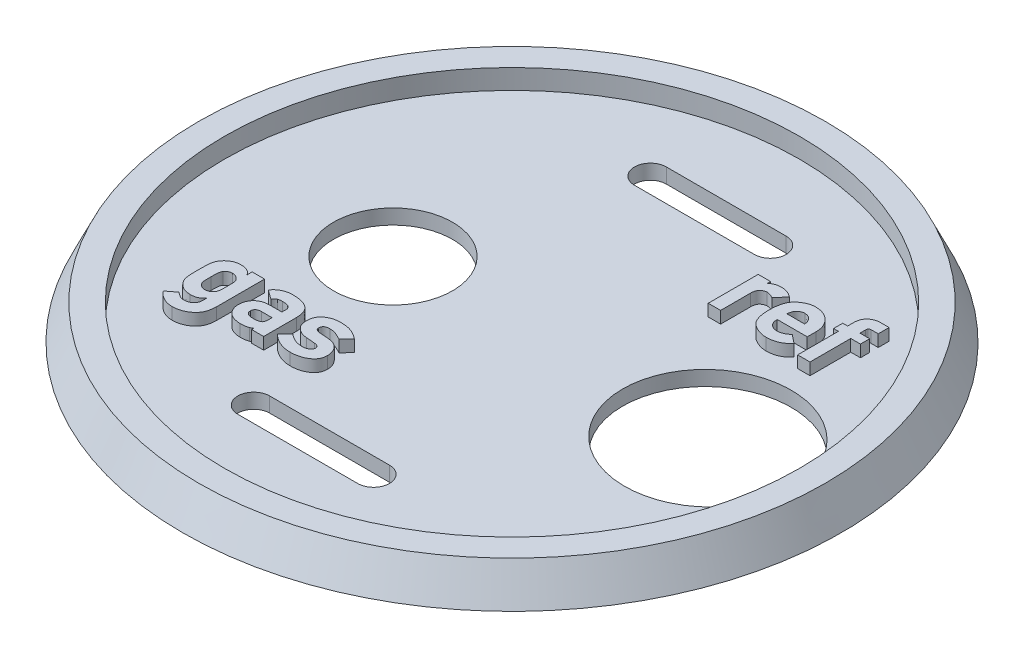
from build123d import *

# Parameters (mm, degrees)
SKIZZE1_R                       = 15.8
SKIZZE1_R_2                     = 3
SKIZZE1_RX                      = 4.3
SKIZZE1_RY                      = 4.2
AUFSATZ_LINEAR_AUSTRAGEN1_DEPTH = 0.75
SKIZZE5_R                       = 15.8
SKIZZE5_R_2                     = 14.5
AUFSATZ_LINEAR_AUSTRAGEN2_DEPTH = 1
FORMSCHR_GE4_ANGLE              = 25
AUFSATZ_LINEAR_AUSTRAGEN3_DEPTH = 0.6


# Read off the part's stored shape, not the designer's step: Aufsatz-Linear austragen3
with BuildPart() as part:
    # Skizze1 → Aufsatz-Linear austragen1 (new body)
    with BuildSketch(Plane(origin=(0, 0, 0), x_dir=(1, 0, 0), z_dir=(0, 1, 0))):
        with Locations(Location((0, 0, 0), (0, 0, 270))):
            Circle(SKIZZE1_R)
        with Locations(Location((-6, 0, 0), (0, 0, 270))):
            Circle(SKIZZE1_R_2, mode=Mode.SUBTRACT)
        with Locations(Location((9.871892508, 0.003631049), (0, 0, -180))):
            Ellipse(SKIZZE1_RX, SKIZZE1_RY, mode=Mode.SUBTRACT)
        with BuildLine():
            Line((-3.021815197, 10.801670903), (3.021815197, 10.801670903))
            ThreePointArc((3.021815197, 10.801670903), (3.8234861, 10), (3.021815197, 9.198329097))
            Line((3.021815197, 9.198329097), (-3.021815197, 9.198329097))
            ThreePointArc((-3.021815197, 9.198329097), (-3.8234861, 10), (-3.021815197, 10.801670903))
        make_face(mode=Mode.SUBTRACT)
        with BuildLine():
            Line((3.021815197, -10.801670903), (-3.021815197, -10.801670903))
            ThreePointArc((-3.021815197, -10.801670903), (-3.8234861, -10), (-3.021815197, -9.198329097))
            Line((-3.021815197, -9.198329097), (3.021815197, -9.198329097))
            ThreePointArc((3.021815197, -9.198329097), (3.8234861, -10), (3.021815197, -10.801670903))
        make_face(mode=Mode.SUBTRACT)
    extrude(amount=AUFSATZ_LINEAR_AUSTRAGEN1_DEPTH)

    # Skizze5 → Aufsatz-Linear austragen2 (add)
    with BuildSketch(Plane(origin=(0, 0.75, 0), x_dir=(1, 0, 0), z_dir=(0, 1, 0))):
        with Locations(Location((0, 0, 0), (0, 0, 270))):
            Circle(SKIZZE5_R)
        with Locations(Location((0, 0, 0), (0, 0, 270))):
            Circle(SKIZZE5_R_2, mode=Mode.SUBTRACT)
    extrude(amount=AUFSATZ_LINEAR_AUSTRAGEN2_DEPTH)

    # Formschräge4
    formschr_ge4_faces = [part.faces().sort_by_distance(p)[0] for p in [
        (0, 0.875, -15.8),
    ]]
    draft(formschr_ge4_faces, Plane.ZX.offset(1.75), FORMSCHR_GE4_ANGLE)

    # Aufsatz-Linear austragen3 outline → Aufsatz-Linear austragen3 (add)
    # profile 1 of 6: a face of its own
    with BuildSketch(Plane(origin=(0, 0.75, 0), x_dir=(1, 0, 0), z_dir=(0, 1, 0))):
        with BuildLine():
            add(Edge.make_bspline(
                [(5.594777271, 7.274511402), (5.572274733, 7.273271201), (5.526936052, 7.270772412), (5.460281754, 7.250652892), (5.395773381, 7.217753155), (5.344286733, 7.181610721), (5.30513894, 7.145816765), (5.280950543, 7.111902892), (5.258951502, 7.07413947), (5.242961741, 7.030608338), (5.227999758, 6.983248107), (5.219580745, 6.930211049), (5.21380078, 6.872644291), (5.212983232, 6.832495351), (5.21256088, 6.811754034)],
                knots=[0, 0, 0, 0, 0.099498386, 0.200471866, 0.3053898, 0.419085264, 0.47808674, 0.539188308, 0.602689317, 0.671038746, 0.743944571, 0.822284683, 0.90819061, 1, 1, 1, 1], degree=3))
            add(Edge.make_bspline(
                [(5.945201171, 7.155112936), (5.912791431, 7.173186855), (5.851868398, 7.207161763), (5.760552823, 7.245632813), (5.675522378, 7.26886791), (5.620563609, 7.272709126), (5.594777271, 7.274511402)],
                knots=[0, 0, 0, 0, 0.297393514, 0.559033041, 0.793100837, 1, 1, 1, 1], degree=3))
            Line((5.945201171, 7.155112936), (6.362036051, 7.624935302))
            add(Edge.make_bspline(
                [(5.763630722, 7.853841237), (5.789331534, 7.853143327), (5.840714801, 7.851748005), (5.917469057, 7.840994572), (5.993127837, 7.82211888), (6.068767837, 7.797547478), (6.143188795, 7.76476734), (6.217477323, 7.725593339), (6.290931032, 7.679001486), (6.338032516, 7.643186891), (6.362036051, 7.624935302)],
                knots=[0, 0, 0, 0, 0.118054796, 0.23602528, 0.355160884, 0.475935911, 0.600954289, 0.7282414, 0.861508245, 1, 1, 1, 1], degree=3))
            add(Edge.make_bspline(
                [(5.212560879, 7.67317947), (5.22020279, 7.679625296), (5.250684407, 7.704257931), (5.307252687, 7.743561141), (5.387005217, 7.783409387), (5.472350426, 7.815723411), (5.563938783, 7.83794777), (5.661704337, 7.851795364), (5.728963181, 7.853145388), (5.763630722, 7.853841237)],
                knots=[0.201261024, 0.201261024, 0.201261024, 0.201261024, 0.241658565, 0.359532571, 0.479274951, 0.601389739, 0.728030172, 0.859817318, 1, 1, 1, 1], degree=3))
            Line((5.212560879, 7.67317947), (5.21256088, 7.825581245))
            Line((5.21256088, 7.825581245), (4.588015058, 7.825581245))
            Line((4.588015058, 7.825581245), (4.588015058, 5.306202965))
            Line((4.588015058, 5.306202965), (5.21256088, 5.306202965))
            Line((5.21256088, 5.306202965), (5.21256088, 6.811754034))
        make_face()
    # profile 2 of 6: a face of its own
    with BuildSketch(Plane(origin=(0, 0.75, 0), x_dir=(1, 0, 0), z_dir=(0, 1, 0))):
        with BuildLine():
            add(Edge.make_bspline(
                [(7.459936738, 7.853841237), (7.49647644, 7.852788335), (7.568623396, 7.850709401), (7.675144541, 7.837274056), (7.777594798, 7.814027121), (7.875931582, 7.78113422), (7.970558428, 7.739434321), (8.060781286, 7.687438107), (8.147830715, 7.627309908), (8.228857683, 7.557353184), (8.304469929, 7.481502005), (8.369808136, 7.398077117), (8.425314913, 7.309303247), (8.47076957, 7.214751355), (8.506025266, 7.114732059), (8.531763737, 7.009247005), (8.546574256, 6.898136191), (8.548420066, 6.822159651), (8.549359426, 6.783494043)],
                knots=[0, 0, 0, 0, 0.064232761, 0.126826381, 0.188388862, 0.248608799, 0.308842963, 0.369844725, 0.431400246, 0.494533665, 0.557766089, 0.619382831, 0.680378974, 0.741481792, 0.803414805, 0.86647081, 0.932044978, 1, 1, 1, 1], degree=3))
            add(Edge.make_bspline(
                [(6.412904037, 6.556707607), (6.413613866, 6.615395493), (6.414976698, 6.728073086), (6.431931536, 6.889984204), (6.457020626, 7.03844676), (6.494384065, 7.172856119), (6.541585953, 7.293761227), (6.599534611, 7.400664124), (6.668286685, 7.494002801), (6.748542973, 7.571362761), (6.833521428, 7.637126774), (6.919954725, 7.694788027), (7.007670629, 7.743558821), (7.096075416, 7.784224462), (7.185469608, 7.815608799), (7.275902201, 7.837403862), (7.367404437, 7.851616389), (7.429034069, 7.853098213), (7.459936738, 7.853841237)],
                knots=[0, 0, 0, 0, 0.093520416, 0.179554186, 0.259240353, 0.333296408, 0.401549333, 0.465730169, 0.52662602, 0.585563443, 0.642792451, 0.69777167, 0.751047831, 0.802626189, 0.852732437, 0.901812665, 0.950766367, 1, 1, 1, 1], degree=3))
            add(Edge.make_bspline(
                [(7.534825716, 5.277942973), (7.502532424, 5.278875348), (7.437991379, 5.280738782), (7.341289775, 5.292223544), (7.245256084, 5.311826193), (7.150358366, 5.34072537), (7.056023962, 5.375969744), (6.962219719, 5.419346154), (6.869444962, 5.471184594), (6.777030772, 5.529351508), (6.690066646, 5.600685514), (6.614664242, 5.689644475), (6.551464405, 5.794998302), (6.501123675, 5.916695863), (6.461019938, 6.053836551), (6.432542951, 6.207175214), (6.415830387, 6.376648252), (6.413907458, 6.494966785), (6.412904037, 6.556707607)],
                knots=[0, 0, 0, 0, 0.049929251, 0.099788093, 0.150343999, 0.201260482, 0.25299445, 0.305939118, 0.360860028, 0.41721413, 0.474600885, 0.533996877, 0.596564565, 0.663783815, 0.737055331, 0.817104758, 0.904561844, 1, 1, 1, 1], degree=3))
            add(Edge.make_bspline(
                [(8.50273044, 5.715972848), (8.469190001, 5.678172719), (8.403697712, 5.604362803), (8.293575803, 5.510034711), (8.177261038, 5.433293975), (8.055036271, 5.374491206), (7.9285532, 5.332157532), (7.799862178, 5.300410445), (7.668192241, 5.281802089), (7.579391591, 5.279232538), (7.534825716, 5.277942973)],
                knots=[0, 0, 0, 0, 0.137781087, 0.269036401, 0.394342038, 0.517075142, 0.637997965, 0.757705624, 0.878401107, 1, 1, 1, 1], degree=3))
            Line((8.50273044, 5.715972848), (8.068939564, 6.060744749))
            add(Edge.make_bspline(
                [(7.524934719, 5.826893316), (7.54853129, 5.827514794), (7.595762063, 5.828758742), (7.665819561, 5.84065769), (7.735083284, 5.859230483), (7.803667177, 5.884792827), (7.871913088, 5.917409564), (7.938860775, 5.957925145), (8.005273026, 6.005645328), (8.04731605, 6.042030945), (8.068939564, 6.060744749)],
                knots=[0, 0, 0, 0, 0.116758416, 0.233703032, 0.350810329, 0.471463667, 0.595600107, 0.724793131, 0.858455956, 1, 1, 1, 1], degree=3))
            add(Edge.make_bspline(
                [(7.037449858, 6.335573171), (7.037742132, 6.31552616), (7.038311456, 6.276476372), (7.046035562, 6.219890072), (7.055987857, 6.1664636), (7.071721467, 6.11705467), (7.091406778, 6.071080433), (7.116547517, 6.029565411), (7.144774424, 5.990654905), (7.188840662, 5.945250782), (7.251771049, 5.898312323), (7.335517332, 5.856243021), (7.427971776, 5.831791453), (7.492057736, 5.828554115), (7.524934719, 5.826893316)],
                knots=[0, 0, 0, 0, 0.075640559, 0.147341055, 0.215362118, 0.280617751, 0.342744036, 0.40375269, 0.463517074, 0.523900249, 0.642004498, 0.758140234, 0.8759226, 1, 1, 1, 1], degree=3))
            Line((7.037449858, 6.335573171), (8.549359426, 6.335573171))
            Line((8.549359426, 6.335573171), (8.549359426, 6.783494043))
        make_face()
        with BuildLine():
            add(Edge.make_bspline(
                [(7.459936738, 7.302064894), (7.432917493, 7.300615242), (7.379482064, 7.297748294), (7.302051701, 7.273270739), (7.230452637, 7.232787905), (7.165679117, 7.177496065), (7.109622734, 7.108888779), (7.069319637, 7.025966997), (7.044313182, 6.931128883), (7.039812077, 6.863960547), (7.037449858, 6.82871003)],
                knots=[0, 0, 0, 0, 0.114540899, 0.226525281, 0.341149106, 0.46177623, 0.586259529, 0.714623416, 0.850231929, 1, 1, 1, 1], degree=3))
            add(Edge.make_bspline(
                [(7.926933104, 6.82871003), (7.923852436, 6.862109571), (7.917871736, 6.926950249), (7.889855632, 7.018949027), (7.846113664, 7.101026953), (7.787797388, 7.171551451), (7.719057837, 7.229995441), (7.639994866, 7.271816101), (7.552650426, 7.297478224), (7.491437307, 7.300506519), (7.459936738, 7.302064894)],
                knots=[0, 0, 0, 0, 0.135981388, 0.263989416, 0.387677885, 0.511392248, 0.633633148, 0.751750516, 0.872249606, 1, 1, 1, 1], degree=3))
            Line((7.926933104, 6.82871003), (7.037449858, 6.82871003))
        make_face(mode=Mode.SUBTRACT)
    # profile 3 of 6: a face of its own
    with BuildSketch(Plane(origin=(0, 0.75, 0), x_dir=(1, 0, 0), z_dir=(0, 1, 0))):
        with BuildLine():
            add(Edge.make_bspline(
                [(9.841547557, 8.257252621), (9.831809849, 8.257058821), (9.813381816, 8.256692066), (9.788060769, 8.24821283), (9.765969731, 8.236470062), (9.748699392, 8.218289329), (9.734041825, 8.196373757), (9.725468034, 8.168480589), (9.719746554, 8.136448206), (9.719009282, 8.113394918), (9.718616592, 8.101116166)],
                knots=[0, 0, 0, 0, 0.128040819, 0.242309607, 0.349707563, 0.455421277, 0.570325014, 0.695414922, 0.837770441, 1, 1, 1, 1], degree=3))
            Line((9.841547557, 8.257252621), (10.207514453, 8.257252621))
            Line((10.207514453, 8.257252621), (10.207514453, 8.806202965))
            Line((10.207514453, 8.806202965), (9.801277069, 8.806202965))
            add(Edge.make_bspline(
                [(9.09619027, 8.101116166), (9.09656361, 8.130117438), (9.097288398, 8.186419475), (9.10768474, 8.26766218), (9.122950808, 8.343423282), (9.144648104, 8.413401033), (9.172852897, 8.477587295), (9.2081169, 8.535482188), (9.248889448, 8.588151597), (9.29674375, 8.634103841), (9.349208761, 8.67394115), (9.404248781, 8.709640812), (9.462834216, 8.739382597), (9.524417337, 8.764359855), (9.589335047, 8.783165185), (9.657146108, 8.796774671), (9.728093718, 8.804466788), (9.776531487, 8.805615909), (9.801277069, 8.806202965)],
                knots=[0, 0, 0, 0, 0.076827064, 0.149149332, 0.216733255, 0.281496126, 0.3429806, 0.402079863, 0.460775488, 0.519051306, 0.577363893, 0.635203383, 0.692718536, 0.751261247, 0.811117321, 0.871598448, 0.934403027, 1, 1, 1, 1], degree=3))
            Line((9.09619027, 8.101116166), (9.09619027, 7.825581245))
            Line((9.09619027, 7.825581245), (8.85032834, 7.825581245))
            Line((8.85032834, 7.825581245), (8.85032834, 7.360704378))
            Line((8.85032834, 7.360704378), (9.09619027, 7.360704378))
            Line((9.09619027, 7.360704378), (9.09619027, 5.306202965))
            Line((9.09619027, 5.306202965), (9.718616592, 5.306202965))
            Line((9.718616592, 5.306202965), (9.718616592, 7.360704378))
            Line((9.718616592, 7.360704378), (10.207514453, 7.360704378))
            Line((10.207514453, 7.360704378), (10.207514453, 7.825581245))
            Line((10.207514453, 7.825581245), (9.718616592, 7.825581245))
            Line((9.718616592, 7.825581245), (9.718616592, 8.101116166))
        make_face()
    # profile 4 of 6: a face of its own
    with BuildSketch(Plane(origin=(0, 0.75, 0), x_dir=(1, 0, 0), z_dir=(0, 1, 0))):
        with BuildLine():
            add(Edge.make_bspline(
                [(-8.786462717, -7.773772884), (-8.750525686, -7.772411654), (-8.681129221, -7.76978304), (-8.58256476, -7.745976557), (-8.493941845, -7.707549942), (-8.429851593, -7.661708841), (-8.385281972, -7.618312236), (-8.355934764, -7.582245251), (-8.332286098, -7.542063851), (-8.311054642, -7.499475608), (-8.295801964, -7.452780696), (-8.285676632, -7.402943878), (-8.277898491, -7.35011163), (-8.277356689, -7.313637581), (-8.277076363, -7.294766021)],
                knots=[0, 0, 0, 0, 0.136119332, 0.262854222, 0.382020109, 0.500491066, 0.55923121, 0.617678621, 0.67619424, 0.7357169, 0.797855953, 0.861798346, 0.928494889, 1, 1, 1, 1], degree=3))
            add(Edge.make_bspline(
                [(-9.240035587, -7.554051447), (-9.21780473, -7.571430438), (-9.175340854, -7.604626607), (-9.112548294, -7.649057808), (-9.054294186, -7.686707139), (-9.000227135, -7.718841305), (-8.947350391, -7.743469815), (-8.894193833, -7.76055335), (-8.840622097, -7.771710083), (-8.80441357, -7.773089179), (-8.786462717, -7.773772884)],
                knots=[0, 0, 0, 0, 0.16476028, 0.314713908, 0.448984483, 0.569751839, 0.681744177, 0.788727359, 0.895258815, 1, 1, 1, 1], degree=3))
            Line((-9.240035587, -7.554051447), (-9.68583696, -7.895290849))
            add(Edge.make_bspline(
                [(-8.795647214, -8.353102719), (-8.836485636, -8.351792731), (-8.918279946, -8.349168988), (-9.03998382, -8.326225322), (-9.159785748, -8.289236204), (-9.277207727, -8.238310733), (-9.390197164, -8.173395519), (-9.496935207, -8.094312728), (-9.596349618, -8.001240389), (-9.655669934, -7.931007437), (-9.68583696, -7.895290849)],
                knots=[0, 0, 0, 0, 0.118194245, 0.236728465, 0.357330633, 0.480744861, 0.606629784, 0.733905784, 0.864679226, 1, 1, 1, 1], degree=3))
            add(Edge.make_bspline(
                [(-7.652530541, -7.241072036), (-7.653686742, -7.285858504), (-7.655933398, -7.37288465), (-7.671258653, -7.49933024), (-7.698118177, -7.617215555), (-7.735399455, -7.726582703), (-7.783610986, -7.827445174), (-7.843587509, -7.918852863), (-7.913195593, -8.002704452), (-7.993876099, -8.076175525), (-8.08140643, -8.140327698), (-8.172269289, -8.197578677), (-8.267016866, -8.245846316), (-8.365936121, -8.284340791), (-8.467869689, -8.316443777), (-8.574160137, -8.336490955), (-8.683618397, -8.351068254), (-8.757915851, -8.35241751), (-8.795647214, -8.353102719)],
                knots=[0, 0, 0, 0, 0.074731466, 0.145213318, 0.212134603, 0.276136519, 0.337653162, 0.398147114, 0.458123181, 0.519029285, 0.579705489, 0.639022636, 0.698073635, 0.756817859, 0.815989033, 0.876102698, 0.937079755, 1, 1, 1, 1], degree=3))
            Line((-7.652530541, -7.241072036), (-7.652530541, -4.822723227))
            Line((-7.652530541, -4.822723227), (-8.277076363, -4.822723227))
            Line((-8.277076363, -4.822723227), (-8.277076363, -5.082715153))
            add(Edge.make_bspline(
                [(-8.859232196, -4.794463235), (-8.826448994, -4.795170045), (-8.762941466, -4.796539276), (-8.671422403, -4.810086574), (-8.587088212, -4.832525848), (-8.510224485, -4.864590995), (-8.440045529, -4.905024521), (-8.377361567, -4.954917652), (-8.321996085, -5.014209066), (-8.292215639, -5.059626573), (-8.277076363, -5.082715153)],
                knots=[0, 0, 0, 0, 0.144192803, 0.279329894, 0.406041415, 0.527299421, 0.644796431, 0.761334228, 0.87867115, 1, 1, 1, 1], degree=3))
            add(Edge.make_bspline(
                [(-9.536059003, -5.110268645), (-9.520170754, -5.091791256), (-9.486988731, -5.053201908), (-9.427414633, -4.99963013), (-9.358035828, -4.946980153), (-9.279500345, -4.895103086), (-9.190163068, -4.849065786), (-9.088754146, -4.817002234), (-8.977246575, -4.79774013), (-8.899585005, -4.795583708), (-8.859232196, -4.794463235)],
                knots=[0, 0, 0, 0, 0.094503238, 0.197366533, 0.310162489, 0.432358369, 0.562346021, 0.698777765, 0.843485481, 1, 1, 1, 1], degree=3))
            add(Edge.make_bspline(
                [(-9.728226948, -6.084531867), (-9.728127204, -6.043553278), (-9.727936874, -5.965358155), (-9.725547698, -5.853732982), (-9.723060364, -5.753384973), (-9.718865973, -5.664104595), (-9.713368349, -5.585881958), (-9.706603535, -5.518674275), (-9.698072228, -5.462614038), (-9.68633907, -5.402083539), (-9.664312709, -5.334840055), (-9.630748041, -5.257728894), (-9.588633257, -5.181842296), (-9.553787866, -5.134404403), (-9.536059003, -5.110268645)],
                knots=[0, 0, 0, 0, 0.121158019, 0.231193084, 0.330106756, 0.41793984, 0.495429499, 0.561943363, 0.617581964, 0.663055137, 0.744095482, 0.826108149, 0.911526182, 1, 1, 1, 1], degree=3))
            add(Edge.make_bspline(
                [(-9.536059003, -7.058795088), (-9.553744636, -7.034874302), (-9.588371761, -6.988039222), (-9.63110838, -6.913186279), (-9.664264131, -6.836314982), (-9.686334137, -6.76910184), (-9.698141068, -6.708343365), (-9.706530541, -6.652027023), (-9.713383564, -6.584597135), (-9.718884735, -6.506137046), (-9.723056486, -6.41638491), (-9.725538311, -6.315566015), (-9.72793814, -6.203705607), (-9.728127639, -6.125510465), (-9.728226948, -6.084531867)],
                knots=[0, 0, 0, 0, 0.087878526, 0.17205947, 0.254047613, 0.335063723, 0.380523298, 0.436833554, 0.503327528, 0.580794015, 0.669296142, 0.768876052, 0.878878212, 1, 1, 1, 1], degree=3))
            add(Edge.make_bspline(
                [(-8.859232196, -7.370361499), (-8.899579954, -7.369190339), (-8.977192342, -7.36693751), (-9.088588161, -7.348389728), (-9.190033719, -7.317878162), (-9.279636413, -7.273352262), (-9.357962964, -7.222012587), (-9.427588321, -7.170144804), (-9.487196439, -7.116509499), (-9.520197917, -7.077529538), (-9.536059003, -7.058795088)],
                knots=[0, 0, 0, 0, 0.15681008, 0.301637698, 0.437773802, 0.567193038, 0.68912205, 0.801576812, 0.904634353, 1, 1, 1, 1], degree=3))
            add(Edge.make_bspline(
                [(-8.277076363, -7.089881079), (-8.290760765, -7.112267837), (-8.317861443, -7.156602711), (-8.370329392, -7.214316516), (-8.431313398, -7.26287276), (-8.500536253, -7.30282923), (-8.578563941, -7.333039623), (-8.664694182, -7.354654235), (-8.759178302, -7.368378462), (-8.82503464, -7.369683714), (-8.859232196, -7.370361499)],
                knots=[0, 0, 0, 0, 0.115532549, 0.228801383, 0.341874758, 0.458221664, 0.579939654, 0.709690334, 0.849249417, 1, 1, 1, 1], degree=3))
            Line((-8.277076363, -7.089881079), (-8.277076363, -7.294766021))
        make_face()
        with BuildLine():
            add(Edge.make_bspline(
                [(-9.027379148, -5.544059521), (-9.034801877, -5.554445691), (-9.049960477, -5.575656193), (-9.066454707, -5.612487484), (-9.080271064, -5.653069356), (-9.087482659, -5.691051046), (-9.092141545, -5.726023588), (-9.094679666, -5.759059265), (-9.097657355, -5.798128248), (-9.099694315, -5.84359979), (-9.100844238, -5.894954406), (-9.102511696, -5.952642812), (-9.103108351, -6.016471292), (-9.103020434, -6.061217442), (-9.102974627, -6.084531867)],
                knots=[0, 0, 0, 0, 0.068930126, 0.140768211, 0.217345457, 0.300580394, 0.349429547, 0.408278635, 0.479833513, 0.561492261, 0.654567023, 0.757834485, 0.87382267, 1, 1, 1, 1], degree=3))
            add(Edge.make_bspline(
                [(-8.709454239, -5.37379307), (-8.7269199, -5.374264052), (-8.760933475, -5.375181269), (-8.809811276, -5.384318584), (-8.854458328, -5.400180062), (-8.907893504, -5.428631952), (-8.967870274, -5.475430585), (-9.007373691, -5.520988117), (-9.027379148, -5.544059521)],
                knots=[0, 0, 0, 0, 0.139766457, 0.272188765, 0.396262918, 0.517744212, 0.75577435, 1, 1, 1, 1], degree=3))
            add(Edge.make_bspline(
                [(-8.361149839, -5.544059521), (-8.37921394, -5.524644407), (-8.419001333, -5.481881319), (-8.481028936, -5.437113073), (-8.54043105, -5.404923431), (-8.592156271, -5.38610346), (-8.6492187, -5.375709242), (-8.688924224, -5.374446157), (-8.709454239, -5.37379307)],
                knots=[0, 0, 0, 0, 0.198141517, 0.436419953, 0.56807599, 0.702982708, 0.846425163, 1, 1, 1, 1], degree=3))
            add(Edge.make_bspline(
                [(-8.277076363, -6.084531867), (-8.277028767, -6.061923904), (-8.276937539, -6.018590636), (-8.277559352, -5.956411032), (-8.279177308, -5.900370128), (-8.280373541, -5.850429236), (-8.282379369, -5.806604602), (-8.285401085, -5.768715156), (-8.287873702, -5.736854762), (-8.29255245, -5.702751547), (-8.301112236, -5.665013837), (-8.314784116, -5.621834535), (-8.335753308, -5.58166432), (-8.352666862, -5.556620317), (-8.361149839, -5.544059521)],
                knots=[0, 0, 0, 0, 0.121844607, 0.233542707, 0.335111605, 0.423992886, 0.502776261, 0.571501627, 0.62884148, 0.674971802, 0.756882869, 0.837155051, 0.918325273, 1, 1, 1, 1], degree=3))
            add(Edge.make_bspline(
                [(-8.361149839, -6.624297712), (-8.352699778, -6.611958218), (-8.335977485, -6.587538908), (-8.314614212, -6.548521105), (-8.301152089, -6.506161351), (-8.292491994, -6.468917524), (-8.287881349, -6.435033107), (-8.285397941, -6.403175251), (-8.282382477, -6.365284846), (-8.280341509, -6.320990447), (-8.279208043, -6.270576729), (-8.277553753, -6.214065857), (-8.276935828, -6.151415049), (-8.277027869, -6.107610813), (-8.277076363, -6.084531867)],
                knots=[0, 0, 0, 0, 0.080667624, 0.159637644, 0.238760716, 0.319488309, 0.365650108, 0.423029088, 0.49180135, 0.570638483, 0.662119567, 0.763757771, 0.87553209, 1, 1, 1, 1], degree=3))
            add(Edge.make_bspline(
                [(-8.709454239, -6.793151164), (-8.688684248, -6.79247956), (-8.648776368, -6.791189126), (-8.591501358, -6.781167766), (-8.539407407, -6.764811925), (-8.480808937, -6.73227156), (-8.419125371, -6.687504766), (-8.379420179, -6.644216708), (-8.361149839, -6.624297712)],
                knots=[0, 0, 0, 0, 0.155279299, 0.298356792, 0.433732565, 0.561403888, 0.798180042, 1, 1, 1, 1], degree=3))
            add(Edge.make_bspline(
                [(-9.026672648, -6.624297712), (-9.007163543, -6.64716503), (-8.968328277, -6.69268523), (-8.908540568, -6.738879663), (-8.855313326, -6.767658907), (-8.810356754, -6.782397334), (-8.761431012, -6.791873756), (-8.727164391, -6.79271591), (-8.709454239, -6.793151164)],
                knots=[0, 0, 0, 0, 0.24092831, 0.479597344, 0.601404705, 0.72519233, 0.857970072, 1, 1, 1, 1], degree=3))
            add(Edge.make_bspline(
                [(-9.102974627, -6.084531867), (-9.10302096, -6.108081752), (-9.10310946, -6.153063328), (-9.102511072, -6.217363238), (-9.100824077, -6.275285231), (-9.099790047, -6.326882739), (-9.097360552, -6.372315925), (-9.095573346, -6.411441741), (-9.092876296, -6.444226932), (-9.088118111, -6.478701478), (-9.081261257, -6.516191601), (-9.06608069, -6.555881402), (-9.050100037, -6.59293266), (-9.034400667, -6.613951287), (-9.026672648, -6.624297712)],
                knots=[0, 0, 0, 0, 0.127466721, 0.243468441, 0.348022238, 0.44110786, 0.522776138, 0.594259857, 0.653115812, 0.700707182, 0.782703067, 0.858500229, 0.930346697, 1, 1, 1, 1], degree=3))
        make_face(mode=Mode.SUBTRACT)
    # profile 5 of 6: a face of its own
    with BuildSketch(Plane(origin=(0, 0.75, 0), x_dir=(1, 0, 0), z_dir=(0, 1, 0))):
        with BuildLine():
            add(Edge.make_bspline(
                [(-5.477924162, -4.978859683), (-5.453476789, -4.997190659), (-5.404843785, -5.033656354), (-5.343510746, -5.10180219), (-5.289580447, -5.176891084), (-5.246583407, -5.262169621), (-5.212762356, -5.355924711), (-5.188237426, -5.458524253), (-5.172565751, -5.569968539), (-5.169872049, -5.647390107), (-5.168477251, -5.68747898)],
                knots=[0, 0, 0, 0, 0.113713733, 0.226210002, 0.34025905, 0.457710409, 0.581075285, 0.711234841, 0.850477454, 1, 1, 1, 1], degree=3))
            add(Edge.make_bspline(
                [(-6.240237444, -4.797289234), (-6.201131917, -4.797286634), (-6.124953063, -4.797281569), (-6.01380336, -4.805155758), (-5.909041917, -4.819202939), (-5.810414157, -4.839064867), (-5.71775206, -4.863853469), (-5.631806109, -4.896303687), (-5.55125195, -4.932960975), (-5.50211809, -4.963715764), (-5.477924162, -4.978859683)],
                knots=[0, 0, 0, 0, 0.147516697, 0.287367375, 0.420074106, 0.546069193, 0.66679, 0.781504222, 0.89241083, 1, 1, 1, 1], degree=3))
            add(Edge.make_bspline(
                [(-7.083091704, -5.204233118), (-7.058007149, -5.171029337), (-7.008799639, -5.105894619), (-6.921948422, -5.021530919), (-6.828609647, -4.94913356), (-6.726006198, -4.891630387), (-6.616046701, -4.846533616), (-6.497541574, -4.81682712), (-6.371533173, -4.798370346), (-6.284815085, -4.797656295), (-6.240237444, -4.797289234)],
                knots=[0, 0, 0, 0, 0.127568423, 0.250246601, 0.370391997, 0.489192502, 0.610137655, 0.734093379, 0.863310067, 1, 1, 1, 1], degree=3))
            Line((-7.083091704, -5.204233118), (-6.621747335, -5.535581524))
            add(Edge.make_bspline(
                [(-6.455013383, -5.377325569), (-6.46804495, -5.384160462), (-6.496672492, -5.399175248), (-6.536306221, -5.434993168), (-6.579824273, -5.480106811), (-6.60707071, -5.516160672), (-6.621747335, -5.535581524)],
                knots=[0, 0, 0, 0, 0.18958516, 0.41647773, 0.685678621, 1, 1, 1, 1], degree=3))
            add(Edge.make_bspline(
                [(-6.215509952, -5.346239578), (-6.238836518, -5.346675802), (-6.283442899, -5.347509975), (-6.346987468, -5.352938207), (-6.403818889, -5.362397976), (-6.438603375, -5.372540642), (-6.455013383, -5.377325569)],
                knots=[0, 0, 0, 0, 0.288637, 0.551947997, 0.788625959, 1, 1, 1, 1], degree=3))
            add(Edge.make_bspline(
                [(-5.776773577, -5.614709501), (-5.777753992, -5.592864047), (-5.779636921, -5.550908952), (-5.800783899, -5.492566502), (-5.836370771, -5.44371443), (-5.886196399, -5.405051205), (-5.949643389, -5.376345055), (-6.026201902, -5.356115652), (-6.116583617, -5.346424521), (-6.18110946, -5.34630389), (-6.215509952, -5.346239578)],
                knots=[0, 0, 0, 0, 0.111786507, 0.214690594, 0.313379985, 0.418387172, 0.534693734, 0.668756845, 0.823405216, 1, 1, 1, 1], degree=3))
            Line((-5.776773577, -5.614709501), (-5.776773577, -5.82665944))
            Line((-5.776773577, -5.82665944), (-6.390015402, -5.82736594))
            add(Edge.make_bspline(
                [(-6.996192228, -6.052032876), (-6.978214109, -6.034395551), (-6.942195755, -5.999059965), (-6.880843578, -5.95391459), (-6.81372913, -5.915059744), (-6.740051414, -5.884642035), (-6.660910111, -5.859587132), (-6.576010164, -5.841420494), (-6.484996706, -5.829907066), (-6.422314543, -5.82823007), (-6.390015402, -5.82736594)],
                knots=[0, 0, 0, 0, 0.113570595, 0.227533576, 0.342778521, 0.462826581, 0.586555588, 0.717085203, 0.854218417, 1, 1, 1, 1], degree=3))
            add(Edge.make_bspline(
                [(-7.20249017, -6.592505222), (-7.201700831, -6.566342839), (-7.200145778, -6.514801145), (-7.191142457, -6.438787703), (-7.174769139, -6.365976568), (-7.152211012, -6.296351691), (-7.122873833, -6.23020127), (-7.087667928, -6.166925671), (-7.044893323, -6.107464736), (-7.012517525, -6.070614421), (-6.996192228, -6.052032876)],
                knots=[0, 0, 0, 0, 0.132360153, 0.260758611, 0.386476688, 0.509282776, 0.630354934, 0.751959203, 0.874926954, 1, 1, 1, 1], degree=3))
            add(Edge.make_bspline(
                [(-6.963693238, -7.153466061), (-6.982719872, -7.135018652), (-7.020405338, -7.098480437), (-7.068976765, -7.03737712), (-7.110627958, -6.972708371), (-7.143481546, -6.903856376), (-7.170223913, -6.831590565), (-7.189056084, -6.755316004), (-7.200710237, -6.675055678), (-7.201890121, -6.620334546), (-7.20249017, -6.592505222)],
                knots=[0, 0, 0, 0, 0.12639782, 0.250352257, 0.371668405, 0.492843831, 0.613768678, 0.738920476, 0.867223748, 1, 1, 1, 1], degree=3))
            add(Edge.make_bspline(
                [(-6.32431092, -7.379545997), (-6.358489706, -7.378135752), (-6.424926253, -7.375394527), (-6.521403379, -7.36355239), (-6.611057092, -7.34429642), (-6.694795283, -7.319870451), (-6.771597851, -7.288024779), (-6.842558496, -7.250283251), (-6.907316965, -7.206210936), (-6.945033459, -7.170923897), (-6.963693238, -7.153466061)],
                knots=[0, 0, 0, 0, 0.147655031, 0.28701109, 0.41902609, 0.543196274, 0.663096877, 0.77727366, 0.889808837, 1, 1, 1, 1], degree=3))
            add(Edge.make_bspline(
                [(-5.911008539, -7.315961015), (-5.938359536, -7.325854999), (-5.996721496, -7.346966927), (-6.094300196, -7.365197823), (-6.204831592, -7.377371402), (-6.283056802, -7.378795147), (-6.32431092, -7.379545997)],
                knots=[0, 0, 0, 0, 0.207210134, 0.442148034, 0.705802118, 1, 1, 1, 1], degree=3))
            add(Edge.make_bspline(
                [(-5.776773579, -7.244318737), (-5.793620231, -7.256235243), (-5.836631356, -7.28334705), (-5.883263284, -7.303794881), (-5.911008539, -7.315961015)],
                knots=[0.494785537, 0.494785537, 0.494785537, 0.494785537, 0.699405445, 1, 1, 1, 1], degree=3))
            Line((-5.776773579, -7.244318737), (-5.776773577, -7.351992505))
            Line((-5.776773577, -7.351992505), (-5.168477251, -7.351992505))
            Line((-5.168477251, -7.351992505), (-5.168477251, -5.68747898))
        make_face()
        with BuildLine():
            add(Edge.make_bspline(
                [(-5.86932505, -6.765597672), (-5.861664797, -6.759827695), (-5.845749679, -6.747839858), (-5.827963198, -6.721674251), (-5.811089299, -6.691275468), (-5.7994163, -6.654112445), (-5.788144949, -6.612097614), (-5.781814113, -6.563926737), (-5.777427144, -6.509929995), (-5.776999205, -6.471941176), (-5.776773577, -6.451911762)],
                knots=[0, 0, 0, 0, 0.084516638, 0.175593684, 0.277458405, 0.392404921, 0.519570795, 0.66314381, 0.822394264, 1, 1, 1, 1], degree=3))
            add(Edge.make_bspline(
                [(-6.264964937, -6.831302153), (-6.242116242, -6.831560267), (-6.198282117, -6.832055445), (-6.135163776, -6.82866031), (-6.077342848, -6.825031565), (-6.024885778, -6.818164875), (-5.978309905, -6.807990619), (-5.936744231, -6.797066268), (-5.900578093, -6.783276841), (-5.879331208, -6.771257938), (-5.86932505, -6.765597672)],
                knots=[0, 0, 0, 0, 0.168941645, 0.324106434, 0.467304889, 0.597359684, 0.714867326, 0.819657188, 0.915068086, 1, 1, 1, 1], degree=3))
            add(Edge.make_bspline(
                [(-6.546151857, -6.746522178), (-6.529251139, -6.759666834), (-6.493993825, -6.787088467), (-6.427210205, -6.811958912), (-6.350111683, -6.828570255), (-6.294513654, -6.830354095), (-6.264964937, -6.831302153)],
                knots=[0, 0, 0, 0, 0.213131134, 0.444622022, 0.70483295, 1, 1, 1, 1], degree=3))
            add(Edge.make_bspline(
                [(-6.622453835, -6.569190728), (-6.621665601, -6.587469296), (-6.620161552, -6.622347082), (-6.604330478, -6.670699296), (-6.581222089, -6.713746924), (-6.557909248, -6.735534184), (-6.546151857, -6.746522178)],
                knots=[0, 0, 0, 0, 0.274020865, 0.522865991, 0.759366471, 1, 1, 1, 1], degree=3))
            add(Edge.make_bspline(
                [(-6.299583428, -6.319796299), (-6.325326256, -6.320988901), (-6.373657526, -6.32322797), (-6.440716962, -6.336695118), (-6.497637526, -6.356701023), (-6.544266668, -6.384644604), (-6.580898539, -6.419876434), (-6.606504821, -6.463266731), (-6.620621801, -6.514156182), (-6.621823721, -6.550262024), (-6.622453835, -6.569190728)],
                knots=[0, 0, 0, 0, 0.166623584, 0.312830018, 0.441128452, 0.555388816, 0.662118628, 0.766703617, 0.877692973, 1, 1, 1, 1], degree=3))
            Line((-6.299583428, -6.319796299), (-5.776773577, -6.319796299))
            Line((-5.776773577, -6.319796299), (-5.776773577, -6.451911762))
        make_face(mode=Mode.SUBTRACT)
    # profile 6 of 6: a face of its own
    with BuildSketch(Plane(origin=(0, 0.75, 0), x_dir=(1, 0, 0), z_dir=(0, 1, 0))):
        with BuildLine():
            add(Edge.make_bspline(
                [(-3.821888635, -7.370361499), (-3.873300632, -7.368769693), (-3.97517711, -7.365615419), (-4.125870948, -7.343359997), (-4.272125282, -7.30568766), (-4.414272209, -7.252876254), (-4.552438814, -7.185757562), (-4.685797113, -7.102644376), (-4.815838511, -7.006266213), (-4.895988331, -6.931495694), (-4.936745317, -6.893474136)],
                knots=[0, 0, 0, 0, 0.123920856, 0.245557866, 0.36631729, 0.487384593, 0.610529244, 0.735943137, 0.865724441, 1, 1, 1, 1], degree=3))
            add(Edge.make_bspline(
                [(-2.725400949, -6.578375226), (-2.726297347, -6.608351634), (-2.728052303, -6.667039073), (-2.743397615, -6.752454244), (-2.767794985, -6.833268991), (-2.804090228, -6.908490805), (-2.84822977, -6.980080694), (-2.904661433, -7.044948074), (-2.968928244, -7.106609366), (-3.044110189, -7.160719018), (-3.125578134, -7.209739911), (-3.211892968, -7.253106388), (-3.302992481, -7.289195943), (-3.39825501, -7.318575382), (-3.497769267, -7.342334793), (-3.601997689, -7.358120083), (-3.710532329, -7.368258081), (-3.784421005, -7.36965377), (-3.821888635, -7.370361499)],
                knots=[0, 0, 0, 0, 0.059504719, 0.116497595, 0.171840242, 0.226670354, 0.281963545, 0.338391023, 0.396967125, 0.458536244, 0.521920007, 0.585732223, 0.650192816, 0.716335913, 0.783627186, 0.85323503, 0.925578102, 1, 1, 1, 1], degree=3))
            add(Edge.make_bspline(
                [(-3.514561223, -5.806170946), (-3.479900355, -5.809279698), (-3.412884954, -5.815290346), (-3.316459171, -5.830887245), (-3.228487821, -5.855048247), (-3.147326571, -5.882168096), (-3.074927372, -5.918123529), (-3.009850506, -5.959044711), (-2.952591589, -6.006641425), (-2.904337444, -6.060954219), (-2.861600537, -6.118104974), (-2.826017724, -6.178547359), (-2.79446927, -6.240104962), (-2.768739594, -6.3038392), (-2.750118511, -6.369845462), (-2.735574769, -6.437501283), (-2.727037087, -6.507270463), (-2.725948775, -6.554567289), (-2.725400949, -6.578375226)],
                knots=[0, 0, 0, 0, 0.084319908, 0.163029163, 0.236251626, 0.305193073, 0.370015554, 0.431594637, 0.491141305, 0.549717608, 0.607239306, 0.663804834, 0.719438737, 0.774752725, 0.830013705, 0.885412989, 0.942320011, 1, 1, 1, 1], degree=3))
            Line((-3.514561223, -5.806170946), (-3.917266108, -5.777910954))
            add(Edge.make_bspline(
                [(-4.153237041, -5.593514507), (-4.15285726, -5.605374848), (-4.152113422, -5.628604542), (-4.14141777, -5.661588946), (-4.125738611, -5.691918661), (-4.103420963, -5.71976445), (-4.071518762, -5.743032595), (-4.029260568, -5.760483251), (-3.97659281, -5.771598182), (-3.938037666, -5.775700717), (-3.917266108, -5.777910954)],
                knots=[0, 0, 0, 0, 0.105362515, 0.206363294, 0.305956328, 0.408968454, 0.521558143, 0.654225118, 0.813714019, 1, 1, 1, 1], degree=3))
            add(Edge.make_bspline(
                [(-3.826834134, -5.346239578), (-3.855387374, -5.346950274), (-3.908079905, -5.348261802), (-3.980155401, -5.360001814), (-4.039055648, -5.378526588), (-4.083794768, -5.40780569), (-4.115438335, -5.445181152), (-4.137426943, -5.48852253), (-4.151448554, -5.538734439), (-4.152618636, -5.574573206), (-4.153237041, -5.593514507)],
                knots=[0, 0, 0, 0, 0.181725276, 0.335358249, 0.46391432, 0.572082211, 0.671003871, 0.772307902, 0.879661468, 1, 1, 1, 1], degree=3))
            add(Edge.make_bspline(
                [(-3.146474828, -5.570906513), (-3.177489484, -5.554752009), (-3.237556268, -5.523465215), (-3.325893243, -5.480354778), (-3.409284631, -5.442166204), (-3.488708391, -5.408114076), (-3.567547053, -5.378851068), (-3.650496548, -5.360573746), (-3.737178808, -5.347778089), (-3.796640374, -5.346757711), (-3.826834134, -5.346239578)],
                knots=[0, 0, 0, 0, 0.144728288, 0.280298545, 0.406783791, 0.524273988, 0.638029729, 0.754116705, 0.875143866, 1, 1, 1, 1], degree=3))
            Line((-3.146474828, -5.570906513), (-2.784040432, -5.166788629))
            add(Edge.make_bspline(
                [(-3.826834134, -4.794463235), (-3.771667673, -4.795624504), (-3.665248633, -4.797864653), (-3.511601623, -4.816661123), (-3.369528499, -4.846110216), (-3.238798463, -4.890210351), (-3.116683171, -4.944695953), (-3.000414239, -5.008811494), (-2.888242345, -5.081710987), (-2.818877518, -5.138345225), (-2.784040432, -5.166788629)],
                knots=[0, 0, 0, 0, 0.146046994, 0.281732422, 0.409317041, 0.529622578, 0.646329132, 0.763000687, 0.880971873, 1, 1, 1, 1], degree=3))
            add(Edge.make_bspline(
                [(-4.777782862, -5.588569008), (-4.776996332, -5.556738252), (-4.775468984, -5.494926768), (-4.762881221, -5.405237419), (-4.740544047, -5.322045104), (-4.711165701, -5.244111217), (-4.672037825, -5.172421504), (-4.624102503, -5.106836142), (-4.568073243, -5.046998205), (-4.503239024, -4.994432151), (-4.432881236, -4.947321834), (-4.357830204, -4.906390672), (-4.278951301, -4.871494648), (-4.195951556, -4.843259646), (-4.108977076, -4.821369892), (-4.018226288, -4.806244387), (-3.923876689, -4.795594542), (-3.85959971, -4.794845211), (-3.826834134, -4.794463235)],
                knots=[0, 0, 0, 0, 0.068317696, 0.132664717, 0.193856026, 0.252911166, 0.311052527, 0.368590707, 0.426887916, 0.486505181, 0.547359323, 0.608446121, 0.669787614, 0.732299194, 0.79642738, 0.86208766, 0.929698356, 1, 1, 1, 1], degree=3))
            add(Edge.make_bspline(
                [(-4.036664574, -6.321915799), (-4.062630712, -6.319542207), (-4.113679523, -6.314875781), (-4.188211896, -6.300199972), (-4.259594762, -6.281371593), (-4.327674827, -6.257320882), (-4.392352744, -6.228118375), (-4.453892763, -6.194272371), (-4.5122459, -6.155277454), (-4.566501572, -6.110888086), (-4.616019892, -6.061655309), (-4.65931229, -6.007595958), (-4.696636125, -5.949360309), (-4.72618507, -5.885773564), (-4.749680738, -5.817873588), (-4.765572595, -5.745292713), (-4.775772733, -5.668456865), (-4.777100559, -5.615685539), (-4.777782862, -5.588569008)],
                knots=[0, 0, 0, 0, 0.067332613, 0.132374318, 0.195991422, 0.257963358, 0.318698084, 0.379160901, 0.439242827, 0.499782147, 0.560021022, 0.619321341, 0.678405845, 0.738290234, 0.800061686, 0.86368752, 0.929955869, 1, 1, 1, 1], degree=3))
            Line((-4.036664574, -6.321915799), (-3.606406197, -6.361479788))
            add(Edge.make_bspline(
                [(-3.34994677, -6.555060732), (-3.350753206, -6.541542393), (-3.35231604, -6.515344484), (-3.364655754, -6.478415921), (-3.38521144, -6.44613971), (-3.414026031, -6.418877132), (-3.4515364, -6.398016422), (-3.495745599, -6.380052224), (-3.548409594, -6.367700858), (-3.586328189, -6.363633478), (-3.606406197, -6.361479788)],
                knots=[0, 0, 0, 0, 0.113206587, 0.219389083, 0.322401235, 0.431376098, 0.548245297, 0.680286413, 0.830710715, 1, 1, 1, 1], degree=3))
            add(Edge.make_bspline(
                [(-3.784444146, -6.821411156), (-3.75332176, -6.820639485), (-3.693852185, -6.819164952), (-3.609392189, -6.807012282), (-3.534938713, -6.784707774), (-3.470050165, -6.755877252), (-3.41657765, -6.717990589), (-3.377469492, -6.670932847), (-3.354251055, -6.61516146), (-3.351412793, -6.575530816), (-3.34994677, -6.555060732)],
                knots=[0, 0, 0, 0, 0.16423256, 0.313820435, 0.448702586, 0.573272198, 0.687131858, 0.791372799, 0.892239544, 1, 1, 1, 1], degree=3))
            add(Edge.make_bspline(
                [(-4.534746932, -6.509844745), (-4.505694146, -6.534590307), (-4.448574314, -6.583241831), (-4.358039616, -6.646430055), (-4.266488492, -6.700985045), (-4.17296723, -6.744821381), (-4.077918296, -6.779139788), (-3.981278685, -6.80292728), (-3.883394833, -6.818630888), (-3.817473751, -6.820483106), (-3.784444146, -6.821411156)],
                knots=[0, 0, 0, 0, 0.137695114, 0.270718334, 0.398002687, 0.521982107, 0.642987853, 0.762164085, 0.880832865, 1, 1, 1, 1], degree=3))
            Line((-4.534746932, -6.509844745), (-4.936745317, -6.893474136))
        make_face()
    extrude(amount=AUFSATZ_LINEAR_AUSTRAGEN3_DEPTH)


solid = part.part
